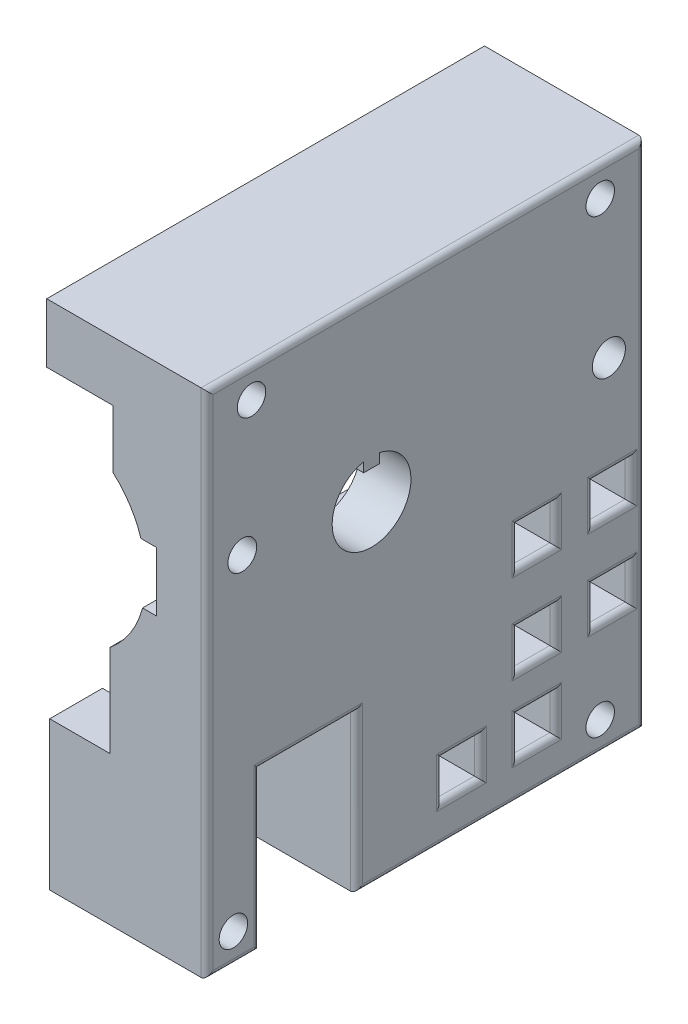
from build123d import *

# Parameters (mm, degrees)
PROFILEEXTRUDE_DEPTH = 73.76
HOSEWINDOW_W         = 16.29
HOSEWINDOW_H         = 26.5
HOSEWINDOWCUT_DEPTH  = 99.014133193
CAGESCREWS_R         = 2.4
CAGESCREWSCUT_DEPTH  = 99.014133193
AXLEHOLECUT_DEPTH    = 99.014133193
SETSCREWS_R          = 2.426338021
SETSCREWS_R_2        = 2.788762315
SETSCREWSCUT_DEPTH   = 99.014133269
SKETCH1_W            = 6.35
SKETCH1_H            = 6.35
CUT_EXTRUDE1_DEPTH   = 99.014133269
FILLET1_R            = 1


with BuildPart() as part:
    # Profile → ProfileExtrude (new body)
    with BuildSketch(Plane.XY):
        with BuildLine():
            Line((-6.01073477, -58.62791746), (-6.01073477, -33.62791746))
            Line((-6.01073477, -33.62791746), (4.13926523, -33.62791746))
            Line((4.13926523, -33.62791746), (4.13926523, -18.13791746))
            ThreePointArc((4.13926523, -18.13791746), (7.563334043, -14.326029686), (9.63126523, -9.63791746))
            Line((9.63126523, -9.63791746), (11.94926523, -9.63791746))
            Line((11.94926523, -9.63791746), (11.94926523, 0.36208254))
            Line((11.94926523, 0.36208254), (9.35926523, 0.36208254))
            ThreePointArc((9.35926523, 0.36208254), (7.493178347, 4.320032013), (4.63926523, 7.63708254))
            Line((4.63926523, 7.63708254), (4.63926523, 17.41208254))
            Line((4.63926523, 17.41208254), (-6.51073477, 17.41208254))
            Line((-6.51073477, 17.41208254), (-6.51073477, 27.41208254))
            Line((-6.51073477, 27.41208254), (20.48926523, 27.41208254))
            Line((20.48926523, 27.41208254), (20.48926523, -58.62791746))
            Line((20.48926523, -58.62791746), (-6.01073477, -58.62791746))
        make_face()
    extrude(amount=PROFILEEXTRUDE_DEPTH)

    # HoseWindow → HoseWindowCut (cut, through all)
    with BuildSketch(Plane(origin=(20.48926523, 0, 0), x_dir=(0, 0, -1), z_dir=(1, 0, 0))):
        with Locations((-56.725, -45.37791746)):
            Rectangle(HOSEWINDOW_W, HOSEWINDOW_H)
    extrude(amount=-HOSEWINDOWCUT_DEPTH, mode=Mode.SUBTRACT)

    # CageScrews → CageScrewsCut (cut, through all)
    with BuildSketch(Plane(origin=(20.48926523, 0, 0), x_dir=(0, 0, -1), z_dir=(1, 0, 0))):
        with Locations((-66.26, 22.41208254)):
            Circle(CAGESCREWS_R)
        with Locations((-7.5, 22.41208254)):
            Circle(CAGESCREWS_R)
        with Locations((-7.5, -53.62791746)):
            Circle(CAGESCREWS_R)
        with Locations((-69.31, -53.62791746)):
            Circle(CAGESCREWS_R)
    extrude(amount=-CAGESCREWSCUT_DEPTH, mode=Mode.SUBTRACT)

    # AxleHole → AxleHoleCut (cut, through all)
    with BuildSketch(Plane(origin=(20.48926523, 0, 0), x_dir=(0, 0, -1), z_dir=(1, 0, 0))):
        with BuildLine():
            Line((-44.699, 2.307293484), (-47.361, 2.307293484))
            Line((-47.361, 2.307293484), (-47.361, 3.926293484))
            ThreePointArc((-47.361, 3.926293484), (-46.03, -9.21691746), (-44.699, 3.926293484))
            Line((-44.699, 3.926293484), (-44.699, 2.307293484))
        make_face()
    extrude(amount=-AXLEHOLECUT_DEPTH, mode=Mode.SUBTRACT)

    # SetScrews → SetScrewsCut (cut, through all)
    with BuildSketch(Plane(origin=(20.48926523, 0, 0), x_dir=(0, 0, -1), z_dir=(1, 0, 0))):
        with Locations((-67.80722939, 0.544946624)):
            Circle(SETSCREWS_R)
        with Locations((-6.04299884, -1.55824191)):
            Circle(SETSCREWS_R_2)
    extrude(amount=-SETSCREWSCUT_DEPTH, mode=Mode.SUBTRACT)

    # Sketch1 → Cut-Extrude1 (cut, through all)
    with BuildSketch(Plane(origin=(20.48926523, 0, 0), x_dir=(0, 0, -1), z_dir=(1, 0, 0))):
        with Locations((-18.175, -49.10291746)):
            Rectangle(SKETCH1_W, SKETCH1_H)
        with Locations((-30.875, -49.10291746)):
            Rectangle(SKETCH1_W, SKETCH1_H)
        with Locations((-5.475, -36.40291746)):
            Rectangle(SKETCH1_W, SKETCH1_H)
        with Locations((-18.175, -36.40291746)):
            Rectangle(SKETCH1_W, SKETCH1_H)
        with Locations((-5.475, -21.40291746)):
            Rectangle(SKETCH1_W, SKETCH1_H)
        with Locations((-18.175, -21.40291746)):
            Rectangle(SKETCH1_W, SKETCH1_H)
    extrude(amount=-CUT_EXTRUDE1_DEPTH, mode=Mode.SUBTRACT)

    # Fillet1
    fillet1_edges = [part.edges().sort_by_distance(p)[0] for p in [
        (20.48926523, -52.27791746, 30.875),
        (20.48926523, -49.10291746, 34.05),
        (20.48926523, -45.92791746, 30.875),
        (20.48926523, -49.10291746, 27.7),
        (20.48926523, -49.10291746, 21.35),
        (20.48926523, -52.27791746, 18.175),
        (20.48926523, -49.10291746, 15),
        (20.48926523, -45.92791746, 18.175),
        (20.48926523, -36.40291746, 8.65),
        (20.48926523, -39.57791746, 5.475),
        (20.48926523, -36.40291746, 2.3),
        (20.48926523, -33.22791746, 5.475),
        (20.48926523, -36.40291746, 21.35),
        (20.48926523, -39.57791746, 18.175),
        (20.48926523, -36.40291746, 15),
        (20.48926523, -33.22791746, 18.175),
        (20.48926523, -21.40291746, 21.35),
        (20.48926523, -24.57791746, 18.175),
        (20.48926523, -21.40291746, 15),
        (20.48926523, -18.22791746, 18.175),
        (20.48926523, -21.40291746, 8.65),
        (20.48926523, -24.57791746, 5.475),
        (20.48926523, -21.40291746, 2.3),
        (20.48926523, -18.22791746, 5.475),
        (20.48926523, -58.62791746, 69.315),
        (20.48926523, -45.37791746, 64.87),
        (20.48926523, -32.12791746, 56.725),
        (20.48926523, -45.37791746, 48.58),
        (20.48926523, -58.62791746, 24.29),
        (20.48926523, -15.60791746, 0),
        (20.48926523, 27.41208254, 36.88),
        (20.48926523, -15.60791746, 73.76),
    ]]
    fillet(fillet1_edges, radius=FILLET1_R)


solid = part.part
